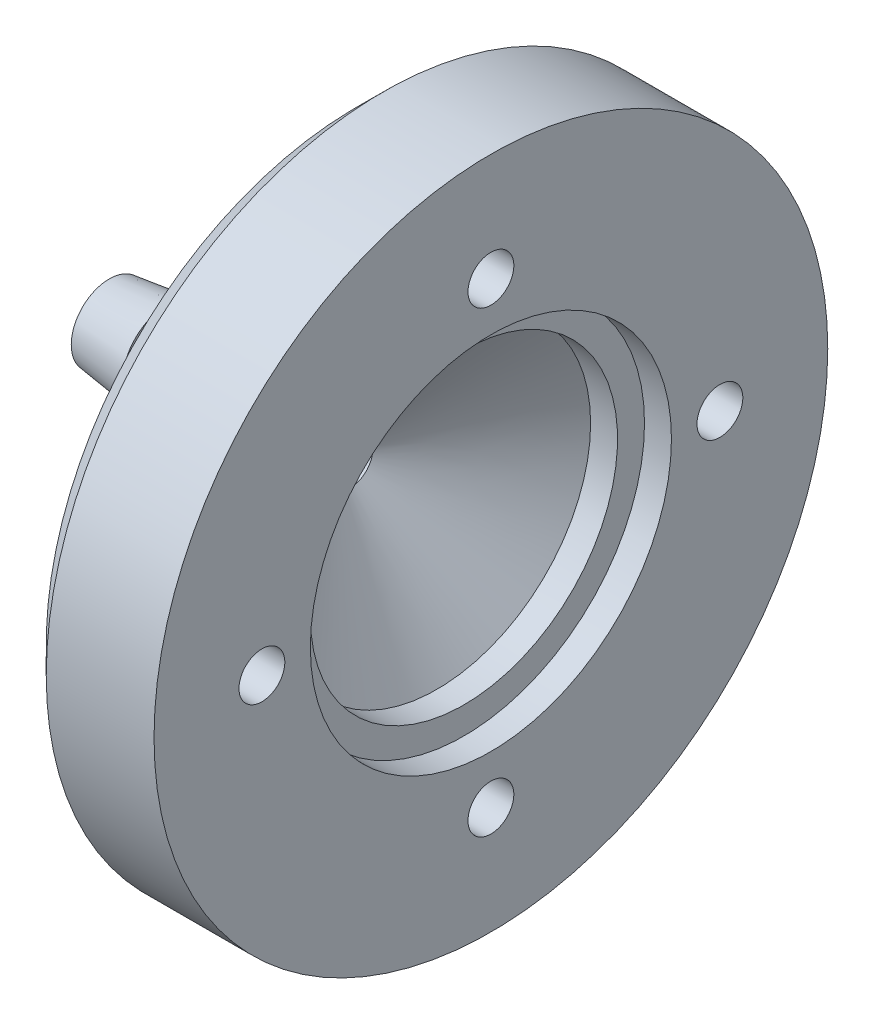
from build123d import *

# Parameters (mm, degrees)
CBORE_FOR_M3_HEX_SOCKET_HEAD_CAP_SCREW2_D           = 3.4
CBORE_FOR_M3_HEX_SOCKET_HEAD_CAP_SCREW2_DEPTH       = 10
CBORE_FOR_M3_HEX_SOCKET_HEAD_CAP_SCREW2_CBORE_D     = 6.5
CBORE_FOR_M3_HEX_SOCKET_HEAD_CAP_SCREW2_CBORE_DEPTH = 3.4
CBORE_FOR_M3_HEX_SOCKET_HEAD_CAP_SCREW2_TIP         = 1.021463052
CHAMFER1_SIZE                                       = 2


with BuildPart() as part:
    # Sketch1 → Revolve17 (revolve)
    with BuildSketch(Plane.XY):
        Polygon((-13.545647488, 3.375), (-13.545647488, 2.82), (-9.212314154, 3.375), (-9.212314154, 2.82), (-4.878980821, 3.375), (0.444201968, 11.4), (0.444201968, 25), (10.444201968, 25), (10.444201968, 13.4), (8.444201968, 13.4), (8.444201968, 11.4), (6.444201968, 11.4), (0, 1.685), (-17.878980821, 1.685), (-17.878980821, 2.82), align=None)
    revolve(axis=Axis((-801.920554309, 0, 0), (1, 0, 0)))

    # CBORE for M3 Hex Socket Head Cap Screw2
    with Locations(Plane.ZY.offset(-0.444201968)):
        with Locations((0, -16.994664238), (0, 16.994664238), (16.994664238, 0), (-16.994664238, 0)):
            CounterBoreHole(CBORE_FOR_M3_HEX_SOCKET_HEAD_CAP_SCREW2_D / 2, CBORE_FOR_M3_HEX_SOCKET_HEAD_CAP_SCREW2_CBORE_D / 2, CBORE_FOR_M3_HEX_SOCKET_HEAD_CAP_SCREW2_CBORE_DEPTH, depth=CBORE_FOR_M3_HEX_SOCKET_HEAD_CAP_SCREW2_DEPTH)
            with Locations((0, 0, -(CBORE_FOR_M3_HEX_SOCKET_HEAD_CAP_SCREW2_DEPTH + CBORE_FOR_M3_HEX_SOCKET_HEAD_CAP_SCREW2_TIP / 2))):  # 118° drill point
                Cone(0, CBORE_FOR_M3_HEX_SOCKET_HEAD_CAP_SCREW2_D / 2, CBORE_FOR_M3_HEX_SOCKET_HEAD_CAP_SCREW2_TIP, mode=Mode.SUBTRACT)

    # Chamfer1
    chamfer1_edges = [part.edges().sort_by_distance(p)[0] for p in [
        (0.444201968, -25, 0),
    ]]
    chamfer(chamfer1_edges, length=CHAMFER1_SIZE)


solid = part.part
